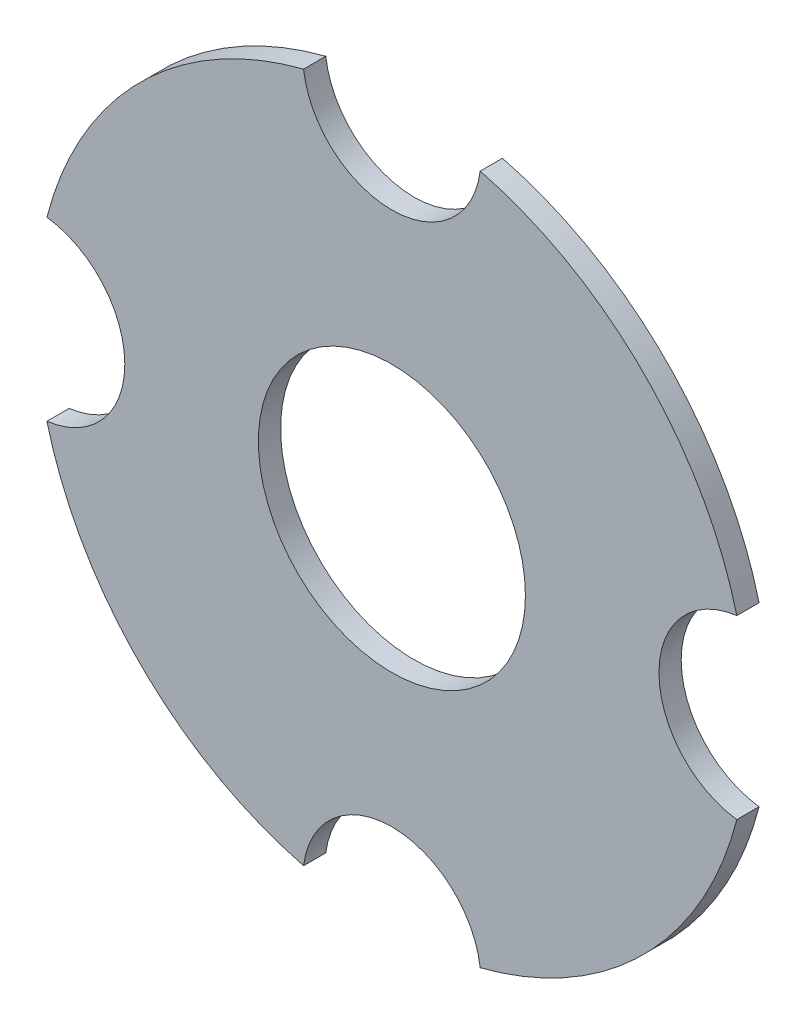
from build123d import *

# Parameters (mm, degrees)
BOSS_EXTRUDE1_OUTLINE_R = 50.8
BOSS_EXTRUDE1_DEPTH     = 3.175
SKETCH2_R               = 19.05
SKETCH2_R_2             = 12.7
CUT_EXTRUDE3_DEPTH      = 3.175


# Read off the part's stored shape, not the designer's step: Boss-Extrude1
with BuildPart() as part:
    # Boss-Extrude1 outline → Boss-Extrude1 (new body)
    with BuildSketch(Plane.XY):
        Circle(BOSS_EXTRUDE1_OUTLINE_R)
    extrude(amount=BOSS_EXTRUDE1_DEPTH)

    # Sketch2 → Cut-Extrude3 (cut)
    with BuildSketch(Plane.XY):
        Circle(SKETCH2_R)
        with Locations((0, 50.8)):
            Circle(SKETCH2_R_2)
        with Locations((50.8, 0)):
            Circle(SKETCH2_R_2)
        with Locations((0, -50.8)):
            Circle(SKETCH2_R_2)
        with Locations((-50.8, 0)):
            Circle(SKETCH2_R_2)
    extrude(amount=CUT_EXTRUDE3_DEPTH, mode=Mode.SUBTRACT)


solid = part.part
